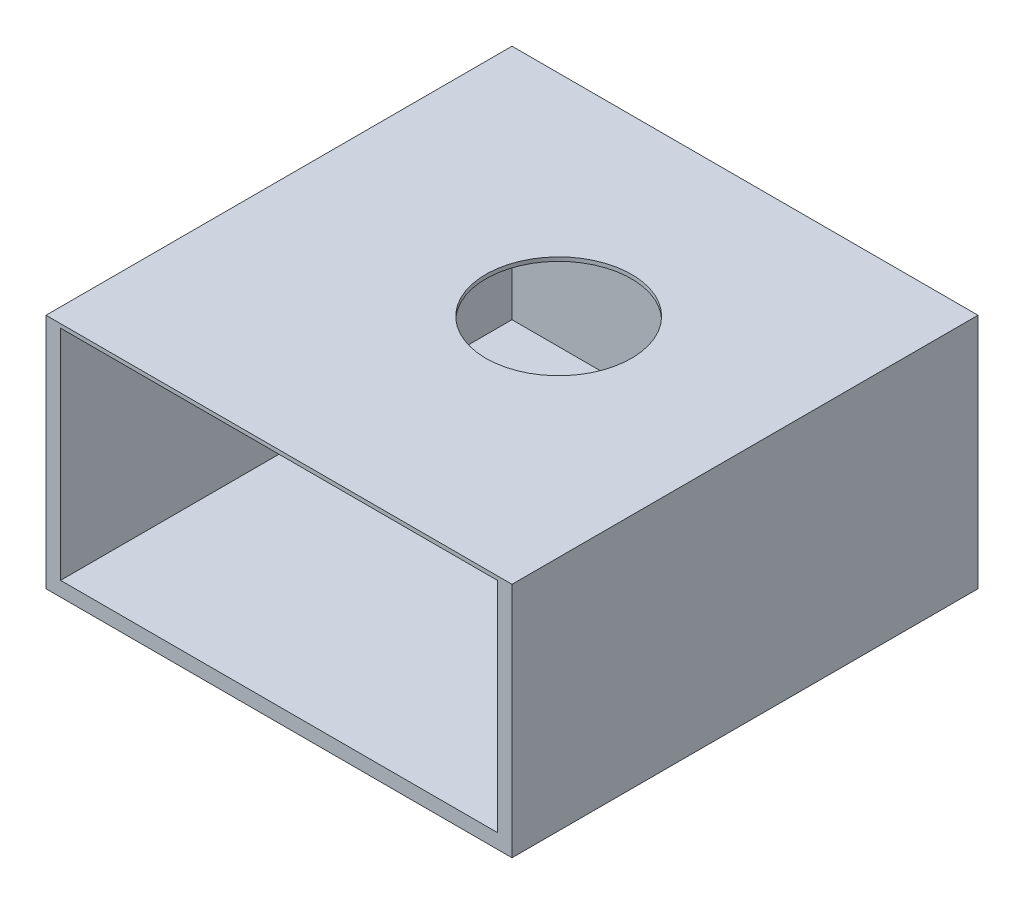
from build123d import *

# Parameters (mm, degrees)
SKETCH1_W           = 304.8
SKETCH1_H           = 152.4
BOSS_EXTRUDE1_DEPTH = 304.8
SHELL1_T            = -9.525
BOSS_EXTRUDE2_DEPTH = 2.54
SKETCH4_R           = 47.625
CUT_EXTRUDE1_DEPTH  = 7.62


with BuildPart() as part:
    # Sketch1 → Boss-Extrude1 (new body)
    with BuildSketch(Plane.XY):
        Rectangle(SKETCH1_W, SKETCH1_H)
    extrude(amount=BOSS_EXTRUDE1_DEPTH)

    # Shell1
    shell1_openings = [part.faces().sort_by_distance(p)[0] for p in [
        (0, 0, 304.8),
        (0, 76.2, 152.4),
    ]]
    offset(amount=SHELL1_T, openings=shell1_openings, kind=Kind.INTERSECTION)

    # Sketch2 → Boss-Extrude2 (add)
    with BuildSketch(Plane(origin=(0, 76.2, 0), x_dir=(1, 0, 0), z_dir=(0, 1, 0))):
        Polygon((-142.875, -304.8), (142.875, -304.8), (152.4, -304.8), (152.4, 0), (-152.4, 0), (-152.4, -304.8), align=None)
    extrude(amount=BOSS_EXTRUDE2_DEPTH)

    # Sketch4 → Cut-Extrude1 (cut)
    with BuildSketch(Plane(origin=(0, 78.74, 0), x_dir=(1, 0, 0), z_dir=(0, 1, 0))):
        with Locations((15.875, -137.740097985)):
            Circle(SKETCH4_R)
    extrude(amount=-CUT_EXTRUDE1_DEPTH, mode=Mode.SUBTRACT)


solid = part.part
